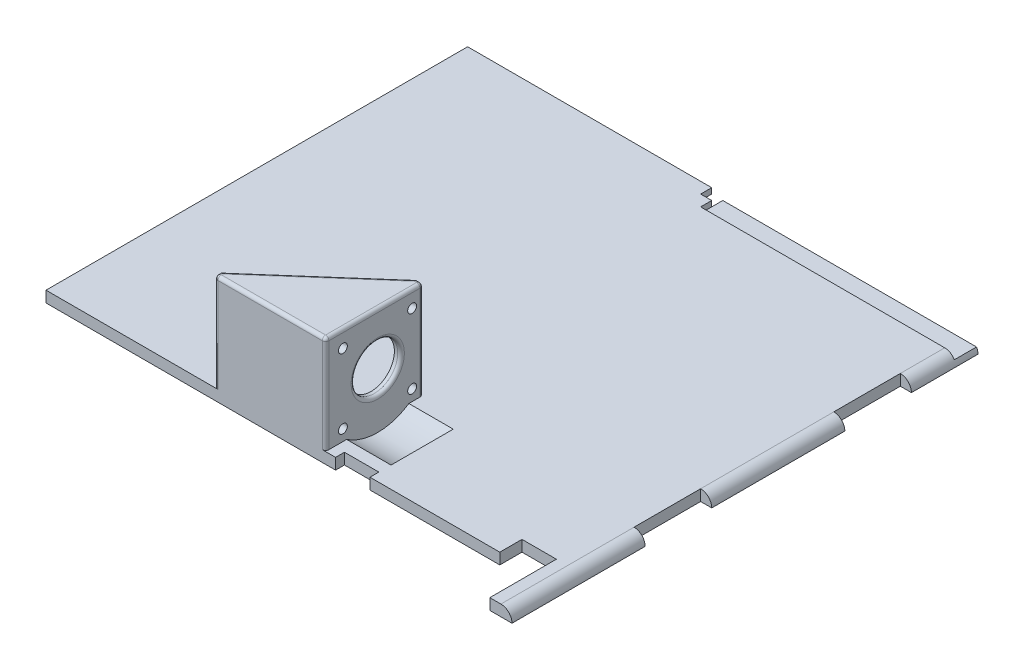
from build123d import *

# Parameters (mm, degrees)
SKETCH_1_W          = 5
SKETCH_1_H          = 60
SKETCH_1_W_2        = 30
SKETCH_1_H_2        = 5
SKETCH_1_W_3        = 15
EXTRUDE_1_DEPTH     = 5
FILLET_1_R          = 5
SKETCH_2_W          = 245
SKETCH_2_H          = 125
CUT_EXTRUDE_1_DEPTH = 5
SKETCH_3_W          = 110
SKETCH_3_H          = 2.5
SKETCH_3_W_2        = 115
CUT_EXTRUDE_2_DEPTH = 10
SKETCH_4_W          = 5
SKETCH_4_H          = 5
CUT_EXTRUDE_3_DEPTH = 5
SKETCH_5_W          = 50
SKETCH_5_H          = 44
EXTRUDE_2_DEPTH     = 47
SKETCH_6_W          = 41.4
SKETCH_6_H          = 41.4
CUT_EXTRUDE_4_DEPTH = 47
SKETCH_7_R          = 10.5
CUT_EXTRUDE_5_DEPTH = 316.582224557
CUT_EXTRUDE_6_DEPTH = 44
SKETCH_10_R         = 2
CUT_EXTRUDE_7_DEPTH = 316.582224557
SKETCH_13_R         = 25
CUT_EXTRUDE_9_DEPTH = 20
FILLET_11_R         = 1.497


with BuildPart() as part:
    # 草圖1 → 填料-伸長1 (new body)
    with BuildSketch(Plane(origin=(0, 0, 0), x_dir=(1, 0, 0), z_dir=(0, 1, 0))):
        Polygon((198.746286718, -286.464902661), (198.746286718, -256.464902661), (183.246286718, -256.464902661), (183.246286718, -266.464902661), (124.746286718, -266.464902661), (124.746286718, -262.464902661), (109.246286718, -262.464902661), (109.246286718, -266.464902661), (-21.253713282, -266.464902661), (-21.253713282, 38.535097339), (-36.253713282, 38.535097339), (-36.253713282, 43.535097339), (203.746286718, 43.535097339), (203.746286718, -286.464902661), align=None)
        with Locations((206.246286718, -256.464902661)):
            Rectangle(SKETCH_1_W, SKETCH_1_H)
        with Locations((206.246286718, 13.535097339)):
            Rectangle(SKETCH_1_W, SKETCH_1_H)
        with Locations((188.746286718, 46.035097339)):
            Rectangle(SKETCH_1_W_2, SKETCH_1_H_2)
        with Locations((-21.253713282, 46.035097339)):
            Rectangle(SKETCH_1_W_2, SKETCH_1_H_2)
        with Locations((91.246286718, 46.035097339)):
            Rectangle(SKETCH_1_W_3, SKETCH_1_H_2)
        with Locations((76.246286718, 46.035097339)):
            Rectangle(SKETCH_1_W_3, SKETCH_1_H_2)
        with Locations((206.246286718, -166.464902661)):
            Rectangle(SKETCH_1_W, SKETCH_1_H)
        with Locations((206.246286718, -76.464902661)):
            Rectangle(SKETCH_1_W, SKETCH_1_H)
    extrude(amount=EXTRUDE_1_DEPTH)

    # 圓角1
    fillet_1_edges = [part.edges().sort_by_distance(p)[0] for p in [
        (208.746286718, 5, -13.535097339),
        (208.746286718, 5, 76.464902661),
        (208.746286718, 5, 166.464902661),
        (208.746286718, 5, 256.464902661),
    ]]
    fillet(fillet_1_edges, radius=FILLET_1_R - 0.0001)  # a hair under: the kernel refuses the full size

    # 草圖2 → 除料-伸長1 (cut)
    with BuildSketch(Plane(origin=(0, 5, 0), x_dir=(1, 0, 0), z_dir=(0, 1, 0))):
        with Locations((86.246286718, -13.964902661)):
            Rectangle(SKETCH_2_W, SKETCH_2_H)
    extrude(amount=-CUT_EXTRUDE_1_DEPTH, mode=Mode.SUBTRACT)

    # 草圖3 → 除料-伸長2 (cut)
    with BuildSketch(Plane(origin=(0, 0, 76.464902661), x_dir=(-1, 0, 0), z_dir=(0, 0, -1))):
        with Locations((-33.746286718, 1.25)):
            Rectangle(SKETCH_3_W, SKETCH_3_H)
        with Locations((-151.246286718, 3.75)):
            Rectangle(SKETCH_3_W_2, SKETCH_3_H)
    extrude(amount=-CUT_EXTRUDE_2_DEPTH, mode=Mode.SUBTRACT)

    # 草圖4 → 除料-伸長3 (cut)
    with BuildSketch(Plane(origin=(0, 0, 76.464902661), x_dir=(-1, 0, 0), z_dir=(0, 0, -1))):
        with Locations((-91.246286718, 2.5)):
            Rectangle(SKETCH_4_W, SKETCH_4_H)
    extrude(amount=-CUT_EXTRUDE_3_DEPTH, mode=Mode.SUBTRACT)

    # 草圖5 → 填料-伸長2 (add)
    with BuildSketch(Plane.XY.offset(266.464902661)):
        with Locations((79.746286718, 27)):
            Rectangle(SKETCH_5_W, SKETCH_5_H)
    extrude(amount=-EXTRUDE_2_DEPTH)

    # 草圖6 → 除料-伸長4 (cut)
    with BuildSketch(Plane.ZY.offset(-54.746286718)):
        with Locations((242.964902661, 25.7)):
            Rectangle(SKETCH_6_W, SKETCH_6_H)
    extrude(amount=-CUT_EXTRUDE_4_DEPTH, mode=Mode.SUBTRACT)

    # 草圖7 → 除料-伸長5 (cut, through all)
    with BuildSketch(Plane.ZY.offset(-101.746286718)):
        with Locations((242.964902661, 25.7)):
            Circle(SKETCH_7_R)
    extrude(amount=-CUT_EXTRUDE_5_DEPTH, mode=Mode.SUBTRACT)

    # 草圖8 → 除料-伸長6 (cut)
    with BuildSketch(Plane(origin=(0, 49, 0), x_dir=(1, 0, 0), z_dir=(0, 1, 0))):
        Polygon((54.746286718, -263.664902661), (101.746286718, -222.464902661), (104.746286718, -222.464902661), (104.746286718, -219.464902661), (54.746286718, -219.464902661), align=None)
    extrude(amount=-CUT_EXTRUDE_6_DEPTH, mode=Mode.SUBTRACT)

    # 草圖10 → 除料-伸長7 (cut, through all)
    with BuildSketch(Plane.ZY.offset(-101.746286718)):
        with Locations((227.464902661, 41.4)):
            Circle(SKETCH_10_R)
        with Locations((258.664902661, 41.4)):
            Circle(SKETCH_10_R)
        with Locations((258.664902661, 10)):
            Circle(SKETCH_10_R)
        with Locations((227.464902661, 10)):
            Circle(SKETCH_10_R)
    extrude(amount=-CUT_EXTRUDE_7_DEPTH, mode=Mode.SUBTRACT)

    # 草圖13 → 除料-伸長9 (cut)
    with BuildSketch(Plane(origin=(104.746286718, 0, 0), x_dir=(0, 0, -1), z_dir=(1, 0, 0))):
        with Locations((-242.964902661, 25.7)):
            Circle(SKETCH_13_R)
    extrude(amount=CUT_EXTRUDE_9_DEPTH, mode=Mode.SUBTRACT)

    # 圓角11
    fillet_11_edges = [part.edges().sort_by_distance(p)[0] for p in [
        (54.746286718, 27, 266.464902661),
        (79.746286718, 49, 266.464902661),
        (104.746286718, 27, 266.464902661),
        (104.746286718, 25.7, 232.464902661),
        (54.746286718, 49, 265.064902661),
        (104.746286718, 49, 244.464902661),
        (104.746286718, 27, 222.464902661),
        (78.246286718, 49, 243.064902661),
        (103.246286718, 49, 222.464902661),
    ]]
    fillet(fillet_11_edges, radius=FILLET_11_R)


solid = part.part
